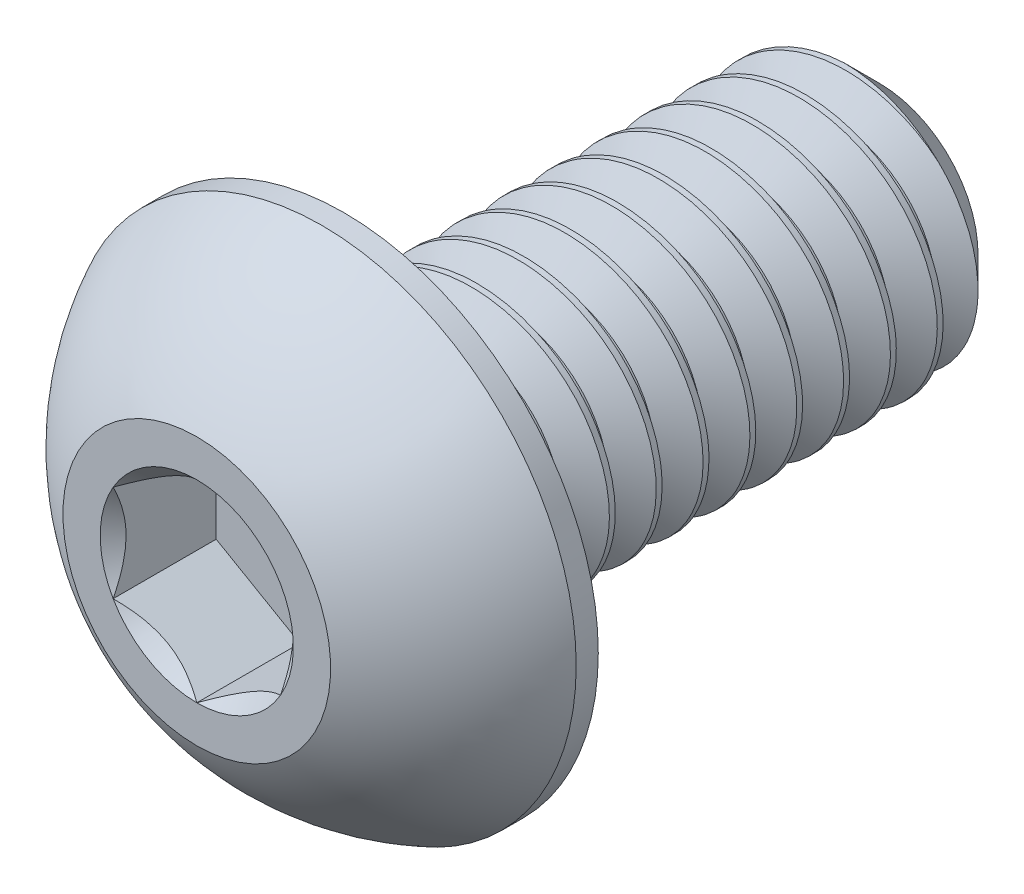
from build123d import *

# Parameters (mm, degrees)
SKETCH1_W          = 8
SKETCH1_H          = 2
CHAMFER1_SIZE      = 0.525
CUT_EXTRUDE2_DEPTH = 1.54
CUT_SWEEP1_PITCH   = 0.7


with BuildPart() as part:
    # Sketch1 → Revolve1 (revolve)
    with BuildSketch(Plane(origin=(0, 0, 0), x_dir=(0, 0, -1), z_dir=(1, 0, 0))):
        with Locations((6.2, 1)):
            Rectangle(SKETCH1_W, SKETCH1_H)
    revolve(axis=Axis((0, 0, -10.2), (0, 0, 1)))

    # Chamfer1
    chamfer1_edges = [part.edges().sort_by_distance(p)[0] for p in [
        (0, -2, -10.2),
    ]]
    chamfer(chamfer1_edges, length=CHAMFER1_SIZE)

    # Sketch7 → Revolve2 (revolve)
    with BuildSketch(Plane(origin=(0, 0, 0), x_dir=(0, 0, -1), z_dir=(1, 0, 0)), mode=Mode.PRIVATE) as revolve2_sk:
        with BuildLine():
            Line((1.87, 3.8), (2.2, 3.8))
            Line((2.2, 3.8), (2.2, 0))
            Line((2.2, 0), (0, 0))
            Line((0, 0), (0, 2))
            ThreePointArc((0, 2), (0.793500147, 3.047002626), (1.87, 3.8))
        make_face()
    revolve(revolve2_sk.sketch.rotate(Axis((0, 0, 0), (0, 0, -1)), 180), axis=Axis((0, 0, 0), (0, 0, -1)))

    # Sketch5 → Cut-Extrude2 (cut)
    with BuildSketch(Plane.XY):
        Polygon((1.25, -0.721687836), (1.25, 0.721687836), (0, 1.443375673), (-1.25, 0.721687836), (-1.25, -0.721687836), (0, -1.443375673), align=None)
    extrude(amount=-CUT_EXTRUDE2_DEPTH, mode=Mode.SUBTRACT)

    # Cut-Extrude3 cone 1 section (through the dimple's axis) → Cut-Extrude3 (revolve, cut)
    with BuildSketch(Plane(origin=(0, 0, 0), x_dir=(0, -1, 0), z_dir=(1, 0, 0))):
        Polygon((0, 0), (1.443375673, 0), (0, 1.443375673), align=None)
    revolve(axis=Axis((0, 0, 0), (0, 0, -1)), mode=Mode.SUBTRACT)

    # Cut-Sweep1: the profile of Sketch2 profile screwed along a right-hand helix of 12.428571 turns, 6 arcs to a turn; built about Z, then put on its axis
    cut_sweep1_z = Axis((0, 0, 0), (0, 0, 1))
    cut_sweep1_corners = [(2.0003, 0, 0.525173205), (2.0003, 0, -0.087673205), (1.545336663, 0, 0.175), (1.545336663, 0, 0.2625)]
    with BuildLine(mode=Mode.PRIVATE) as cut_sweep1_profile:
        Line(cut_sweep1_corners[0], cut_sweep1_corners[1])
        Line(cut_sweep1_corners[1], cut_sweep1_corners[2])
        Line(cut_sweep1_corners[2], cut_sweep1_corners[3])
        Line(cut_sweep1_corners[3], cut_sweep1_corners[0])
    cut_sweep1_cap = Face(cut_sweep1_profile.wire())
    cut_sweep1_turn_angles = [0, 30, 60, 90, 120, 150, 180, 210, 240, 270, 300, 330, 360]
    cut_sweep1_turn_weights = [1, 0.8660254037844387, 1, 0.8660254037844387, 1, 0.8660254037844387, 1, 0.8660254037844387, 1, 0.8660254037844387, 1, 0.8660254037844387, 1]
    cut_sweep1_turn_rails = [Edge.make_bspline([Vector(p[0], p[1], 0).rotate(cut_sweep1_z, cut_sweep1_turn_angles[k]) / cut_sweep1_turn_weights[k] + Vector(0, 0, p[2] + CUT_SWEEP1_PITCH * cut_sweep1_turn_angles[k] / 360) for k in range(13)], [0, 0, 0, 1, 1, 2, 2, 3, 3, 4, 4, 5, 5, 6, 6, 6], 2, cut_sweep1_turn_weights) for p in cut_sweep1_corners]
    cut_sweep1_turn_sides = [Face.make_surface_from_curves(cut_sweep1_turn_rails[p[0]], cut_sweep1_turn_rails[p[1]]) for p in [(0, 1), (1, 2), (2, 3), (3, 0)]]
    cut_sweep1_last_angles = [4320, 4350, 4380, 4410, 4440, 4457.142857143, 4474.285714286]
    cut_sweep1_last_weights = [1, 0.8660254037844387, 1, 0.8660254037844387, 1, 0.9555728057861678, 1]
    cut_sweep1_last_rails = [Edge.make_bspline([Vector(p[0], p[1], 0).rotate(cut_sweep1_z, cut_sweep1_last_angles[k]) / cut_sweep1_last_weights[k] + Vector(0, 0, p[2] + CUT_SWEEP1_PITCH * cut_sweep1_last_angles[k] / 360) for k in range(7)], [0, 0, 0, 1, 1, 2, 2, 3, 3, 3], 2, cut_sweep1_last_weights) for p in cut_sweep1_corners]
    cut_sweep1_last_sides = [Face.make_surface_from_curves(cut_sweep1_last_rails[p[0]], cut_sweep1_last_rails[p[1]]) for p in [(0, 1), (1, 2), (2, 3), (3, 0)]]
    cut_sweep1 = Plane(origin=(0, 0, -10.2), x_dir=(0, 1, 0), z_dir=(0, 0, 1)) * Solid(Shell([*[p.moved(Location((0, 0, CUT_SWEEP1_PITCH * i))) for i in range(12) for p in cut_sweep1_turn_sides], *cut_sweep1_last_sides, cut_sweep1_cap, cut_sweep1_cap.rotate(cut_sweep1_z, 4474.285714286).moved(Location((0, 0, CUT_SWEEP1_PITCH * 4474.285714286 / 360)))]))
    add(cut_sweep1, mode=Mode.SUBTRACT)


solid = part.part
